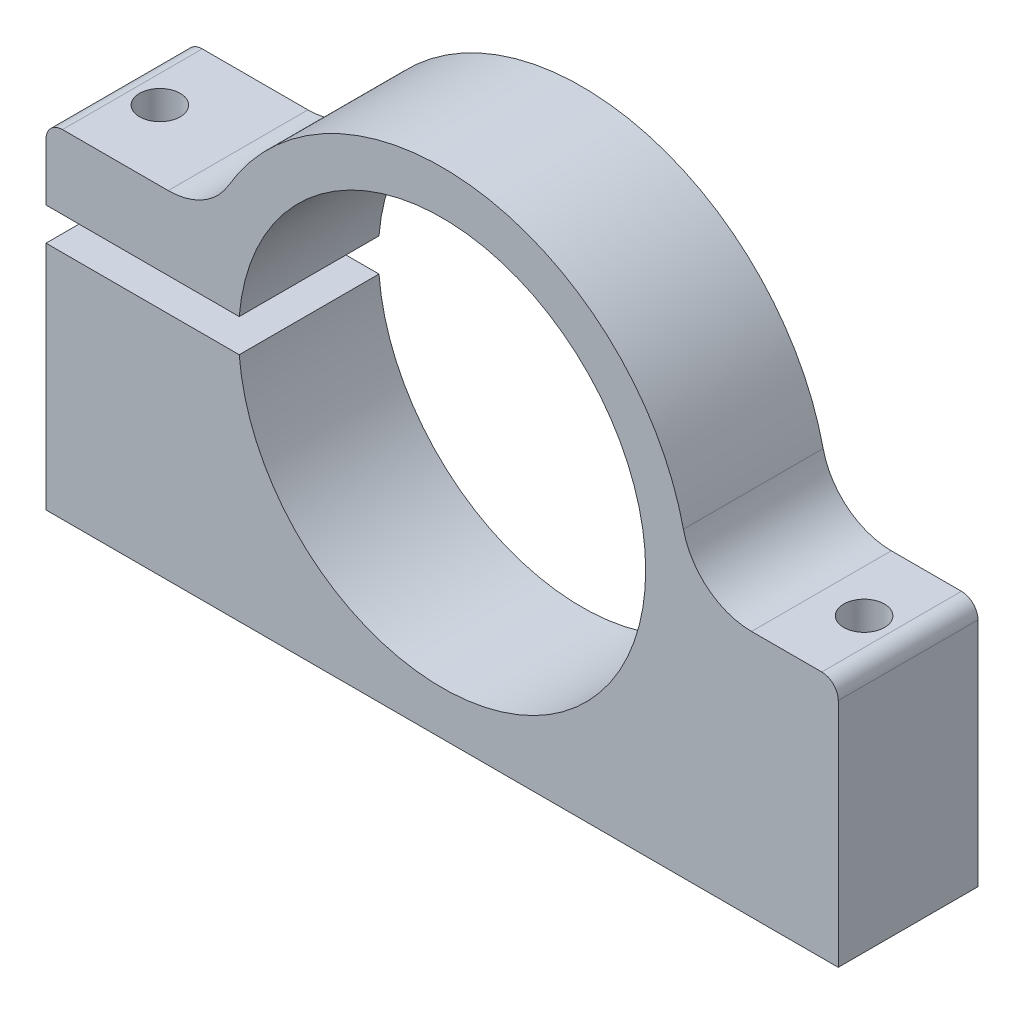
from build123d import *

# Parameters (mm, degrees)
EXTRUDE1_DEPTH     = 12.7
SKETCH2_R          = 18.5
CUT_EXTRUDE1_DEPTH = 45.311849431
SKETCH4_W          = 3.990810773
SKETCH4_H          = 3
CUT_EXTRUDE2_DEPTH = 45.311849431
SKETCH5_R          = 1.85
CUT_EXTRUDE3_DEPTH = 49.981920739
SKETCH6_R          = 1.85
CUT_EXTRUDE4_DEPTH = 45.311849431
FILLET2_R          = 6.35
FILLET3_R          = 6.35
FILLET6_R          = 1.5
FILLET7_R          = 1.5


with BuildPart() as part:
    # Sketch1 → Extrude1 (new body)
    with BuildSketch(Plane.XY):
        with BuildLine():
            Line((-22.429899688, -1.5), (-36, -1.5))
            Line((-36, -1.5), (-36, -22.5))
            Line((-36, -22.5), (36, -22.5))
            Line((36, -22.5), (36, 0))
            Line((36, 0), (22.48, 0))
            ThreePointArc((22.48, 0), (4.167763746, 22.090272641), (-20.93460368, 8.191017566))
            Line((-20.93460368, 8.191017566), (-36, 8.191017566))
            Line((-36, 8.191017566), (-36, 1.5))
            Line((-36, 1.5), (-22.429899688, 1.5))
            Line((-22.429899688, 1.5), (-22.429899688, -1.5))
        make_face()
    extrude(amount=-EXTRUDE1_DEPTH)

    # Sketch2 → Cut-Extrude1 (cut, through all)
    with BuildSketch(Plane.XY):
        Circle(SKETCH2_R)
    extrude(amount=-CUT_EXTRUDE1_DEPTH, mode=Mode.SUBTRACT)

    # Sketch4 → Cut-Extrude2 (cut, through all)
    with BuildSketch(Plane.XY):
        with Locations((-20.434494302, 0)):
            Rectangle(SKETCH4_W, SKETCH4_H)
    extrude(amount=-CUT_EXTRUDE2_DEPTH, mode=Mode.SUBTRACT)

    # Sketch5 → Cut-Extrude3 (cut, through all)
    with BuildSketch(Plane(origin=(0, 8.191017566, 0), x_dir=(1, 0, 0), z_dir=(0, 1, 0))):
        with Locations((-32, 6.35)):
            Circle(SKETCH5_R)
    extrude(amount=-CUT_EXTRUDE3_DEPTH, mode=Mode.SUBTRACT)

    # Sketch6 → Cut-Extrude4 (cut, through all)
    with BuildSketch(Plane(origin=(0, 0, 0), x_dir=(1, 0, 0), z_dir=(0, 1, 0))):
        with Locations((32, 6.35)):
            Circle(SKETCH6_R)
    extrude(amount=-CUT_EXTRUDE4_DEPTH, mode=Mode.SUBTRACT)

    # Fillet2
    fillet2_edges = [part.edges().sort_by_distance(p)[0] for p in [
        (22.48, 0, -6.35),
    ]]
    fillet(fillet2_edges, radius=FILLET2_R)

    # Fillet3
    fillet3_edges = [part.edges().sort_by_distance(p)[0] for p in [
        (-20.93460368, 8.191017566, -6.35),
    ]]
    fillet(fillet3_edges, radius=FILLET3_R)

    # Fillet6
    fillet6_edges = [part.edges().sort_by_distance(p)[0] for p in [
        (36, 0, -6.35),
    ]]
    fillet(fillet6_edges, radius=FILLET6_R)

    # Fillet7
    fillet7_edges = [part.edges().sort_by_distance(p)[0] for p in [
        (-36, 8.191017566, -6.35),
    ]]
    fillet(fillet7_edges, radius=FILLET7_R)


solid = part.part
